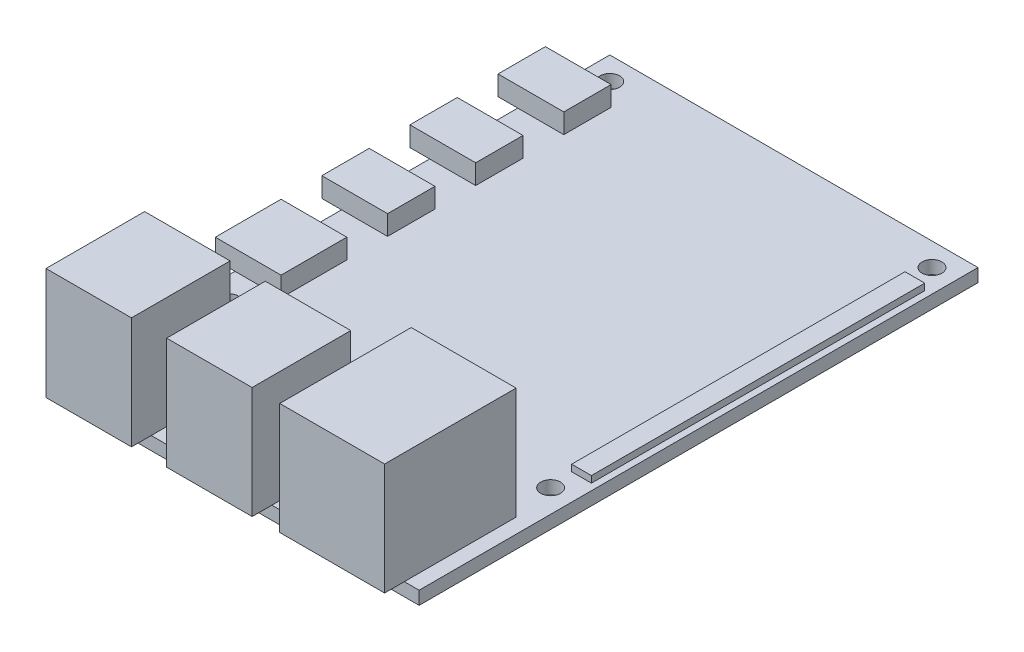
from build123d import *

# Parameters (mm, degrees)
SKETCH1_W           = 56
SKETCH1_H           = 85
SKETCH1_R           = 1.5
BOSS_EXTRUDE1_DEPTH = 2
SKETCH2_W           = 3
SKETCH2_H           = 50.7
BOSS_EXTRUDE2_DEPTH = 1
SKETCH3_W           = 13
SKETCH3_H           = 15
SKETCH3_W_2         = 15.95
SKETCH3_H_2         = 20
BOSS_EXTRUDE3_DEPTH = 17
SKETCH4_W           = 10
SKETCH4_H           = 7.2
SKETCH4_H_2         = 10
BOSS_EXTRUDE4_DEPTH = 3


with BuildPart() as part:
    # Sketch1 → Boss-Extrude1 (new body)
    with BuildSketch(Plane(origin=(0, 0, 0), x_dir=(1, 0, 0), z_dir=(0, 1, 0))):
        Rectangle(SKETCH1_W, SKETCH1_H)
        with Locations((-24.5, 39)):
            Circle(SKETCH1_R, mode=Mode.SUBTRACT)
        with Locations((24.5, 39)):
            Circle(SKETCH1_R, mode=Mode.SUBTRACT)
        with Locations((-24.5, -19)):
            Circle(SKETCH1_R, mode=Mode.SUBTRACT)
        with Locations((24.5, -19)):
            Circle(SKETCH1_R, mode=Mode.SUBTRACT)
    extrude(amount=BOSS_EXTRUDE1_DEPTH)

    # Sketch2 → Boss-Extrude2 (add)
    with BuildSketch(Plane(origin=(0, 2, 0), x_dir=(1, 0, 0), z_dir=(0, 1, 0))):
        with Locations((25.5, 10.05)):
            Rectangle(SKETCH2_W, SKETCH2_H)
    extrude(amount=BOSS_EXTRUDE2_DEPTH)

    # Sketch3 → Boss-Extrude3 (add)
    with BuildSketch(Plane(origin=(0, 2, 0), x_dir=(1, 0, 0), z_dir=(0, 1, 0))):
        with Locations((-19.25, -38)):
            Rectangle(SKETCH3_W, SKETCH3_H)
        with Locations((-0.9, -38)):
            Rectangle(SKETCH3_W, SKETCH3_H)
        with Locations((17.775, -35.5)):
            Rectangle(SKETCH3_W_2, SKETCH3_H_2)
    extrude(amount=BOSS_EXTRUDE3_DEPTH)

    # Sketch4 → Boss-Extrude4 (add)
    with BuildSketch(Plane(origin=(0, 2, 0), x_dir=(1, 0, 0), z_dir=(0, 1, 0))):
        with Locations((-26, 32.1)):
            Rectangle(SKETCH4_W, SKETCH4_H)
        with Locations((-26, 5.3)):
            Rectangle(SKETCH4_W, SKETCH4_H)
        with Locations((-26, -9.5)):
            Rectangle(SKETCH4_W, SKETCH4_H_2)
        with Locations((-26, 18.7)):
            Rectangle(SKETCH4_W, SKETCH4_H)
    extrude(amount=BOSS_EXTRUDE4_DEPTH)


solid = part.part
